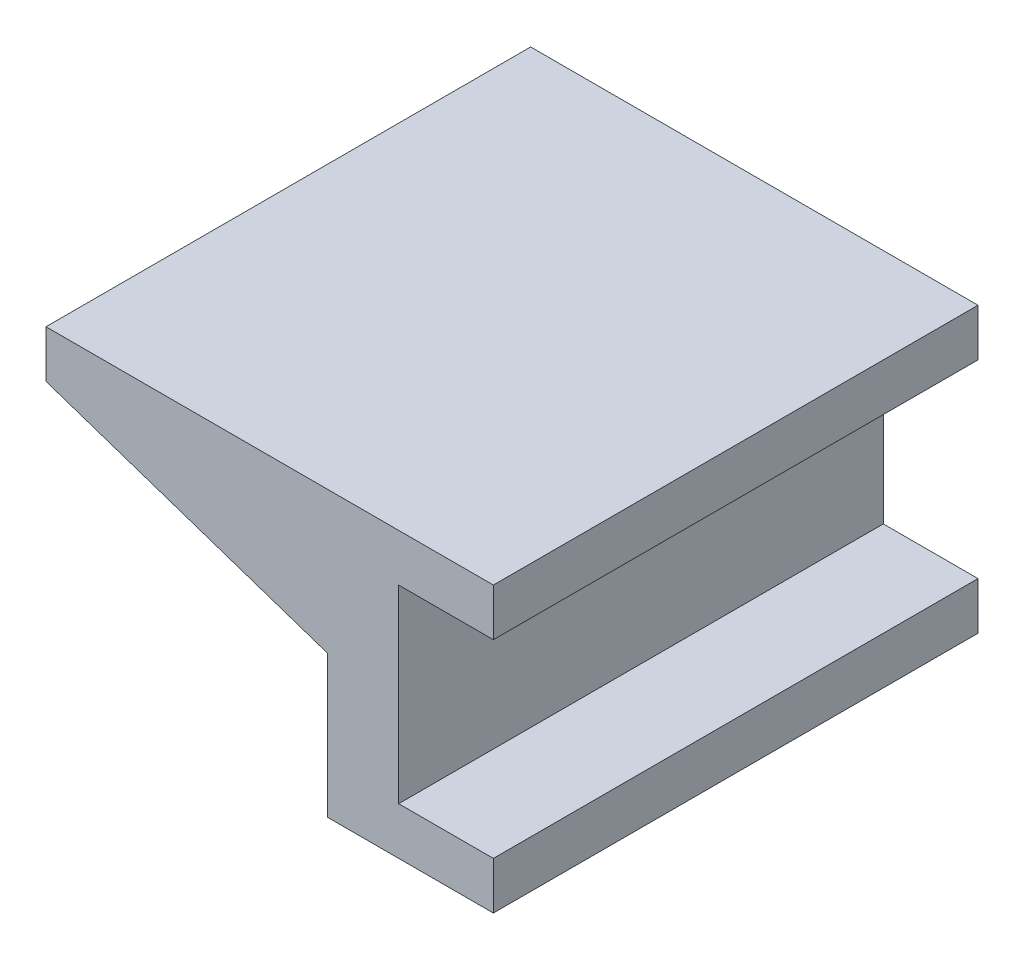
from build123d import *

# Parameters (mm, degrees)
BOSS_EXTRUDE1_DEPTH = 65


with BuildPart() as part:
    # Sketch1 → Boss-Extrude1 (new, symmetric)
    with BuildSketch(Plane.XY):
        Polygon((44.45, 12.7), (-75.55, 12.7), (-75.55, 0), (0, -25.4), (0, -63.5), (44.45, -63.5), (44.45, -50.8), (19.05, -50.8), (19.05, 0), (44.45, 0), align=None)
    extrude(amount=BOSS_EXTRUDE1_DEPTH, both=True)


solid = part.part
